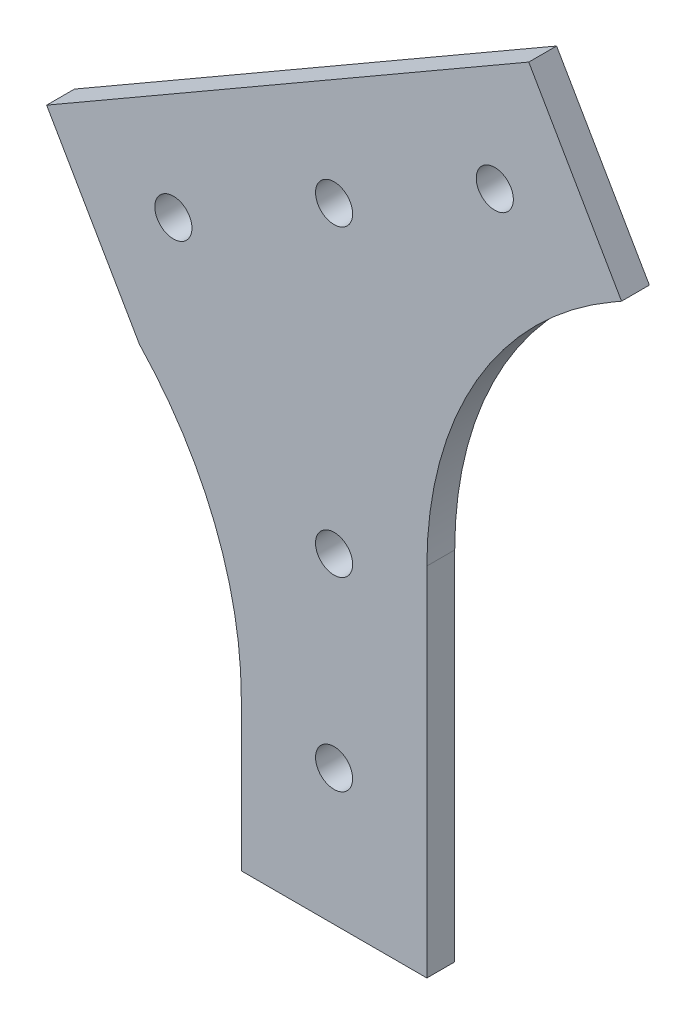
from build123d import *

# Parameters (mm, degrees)
SKETCH_1_R          = 2
SKETCH_1_W          = 20
SKETCH_1_H          = 50
EXTRUDE_1_DEPTH     = 3
FILLET_1_R          = 40
SKETCH_2_R          = 2
CUT_EXTRUDE_1_DEPTH = 10


with BuildPart() as part:
    # 草图1 → 凸台-拉伸1 (new body)
    # profile 1 of 3: a face of its own
    with BuildSketch(Plane.XY):
        Polygon((10, 36.547005384), (-10, 25), (10, 25), align=None)
    # profile 2 of 3: a face of its own
    with BuildSketch(Plane.XY):
        Polygon((20.980762114, 65.980762114), (30.980762114, 48.660254038), (-20.980762114, 18.660254038), (-30.980762114, 35.980762114), align=None)
        with Locations((0, 42.320508076)):
            Circle(SKETCH_1_R, mode=Mode.SUBTRACT)
        with Locations((17.320508076, 52.320508076)):
            Circle(SKETCH_1_R, mode=Mode.SUBTRACT)
        with Locations((-17.320508076, 32.320508076)):
            Circle(SKETCH_1_R, mode=Mode.SUBTRACT)
    # profile 3 of 3: a face of its own
    with BuildSketch(Plane.XY):
        Rectangle(SKETCH_1_W, SKETCH_1_H)
    extrude(amount=EXTRUDE_1_DEPTH)

    # 圆角1
    # the kernel refuses this fillet: 40 mm, written as the material it adds along each edge
    with BuildSketch(Plane(origin=(10, 36.547005384, 0), x_dir=(0, -1, 0), z_dir=(0, 0, 1))) as fillet_1_piece_1:
        with BuildLine():
            CenterArc((FILLET_1_R * 0.57735026919, FILLET_1_R), FILLET_1_R, 210, 60)
            Line((-FILLET_1_R * 0.288675134595, FILLET_1_R * 0.5), (-FILLET_1_R * 0.305995642671, FILLET_1_R * 0.49))
            Line((-FILLET_1_R * 0.305995642671, FILLET_1_R * 0.49), (-FILLET_1_R * 0.0115470053838, -FILLET_1_R * 0.02))
            Line((-FILLET_1_R * 0.0115470053838, -FILLET_1_R * 0.02), (FILLET_1_R * 0.57735026919, -FILLET_1_R * 0.02))
            Line((FILLET_1_R * 0.57735026919, -FILLET_1_R * 0.02), (FILLET_1_R * 0.57735026919, 0))
        make_face()
    extrude(amount=3)
    with BuildSketch(Plane(origin=(-10, 25, 0), x_dir=(-0.8660254037844363, -0.5000000000000041, 0), z_dir=(0, 0, 1))) as fillet_1_piece_2:
        with BuildLine():
            CenterArc((51.575734141, 9.331791971), FILLET_1_R, 150, 43.49112832)
            Line((16.93471799, 29.331791971), (16.241897667, 29.731791971))
            Line((16.241897667, 29.731791971), (-0.692820323, 0.4))
            Line((-0.692820323, 0.4), (0, -0.8))
            ThreePointArc((0, -0.8), (6.339745962, -0.8), (11.90156708, -0.186635839))
            Line((11.90156708, -0.186635839), (12.679491924, 0))
        make_face()
    extrude(amount=3)

    # 草图2 → 切除-拉伸1 (cut)
    with BuildSketch(Plane(origin=(0, 0, 0), x_dir=(-1, 0, 0), z_dir=(0, 0, -1))):
        with Locations((0, 9.601800669)):
            Circle(SKETCH_2_R)
        with Locations((0, -10.398199331)):
            Circle(SKETCH_2_R)
    extrude(amount=-CUT_EXTRUDE_1_DEPTH, mode=Mode.SUBTRACT)


solid = part.part
